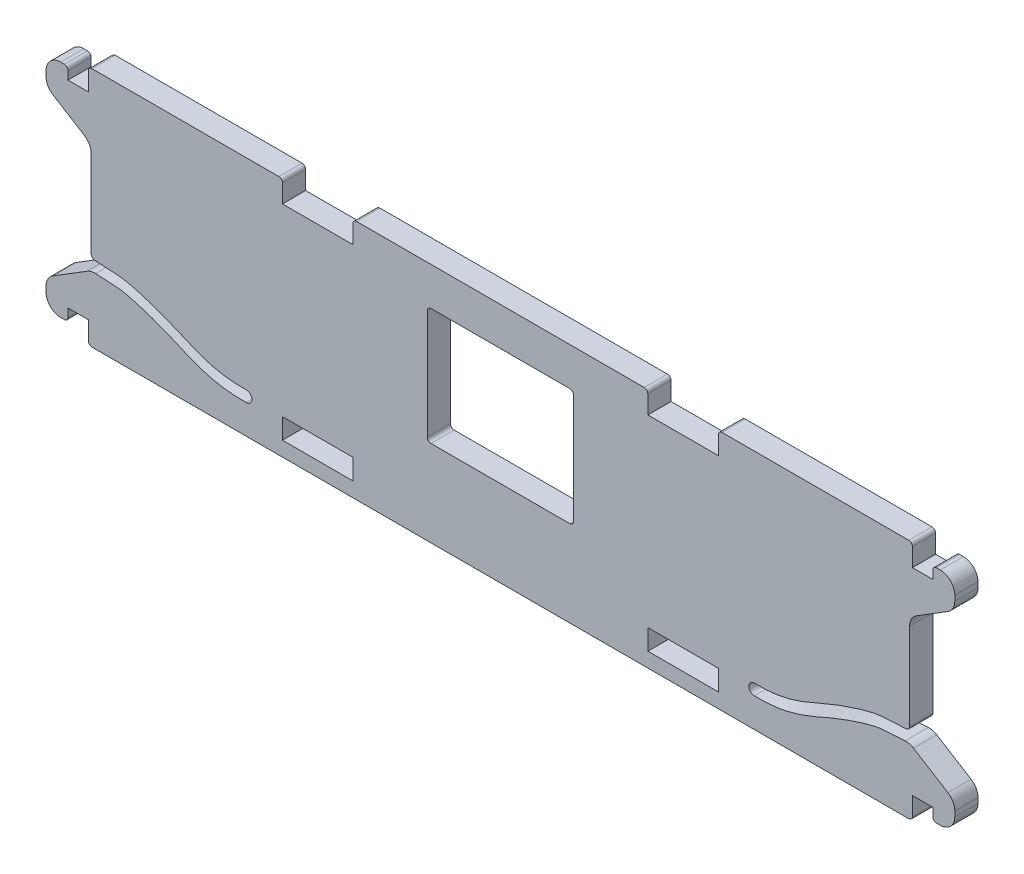
from build123d import *

# Parameters (mm, degrees)
SKETCH1_W           = 124.35
SKETCH1_H           = 33
BOSS_EXTRUDE1_DEPTH = 3.175
SKETCH2_W           = 9.65
SKETCH2_H           = 2.8
SKETCH2_H_2         = 3
CUT_EXTRUDE1_DEPTH  = 65.405444257
SKETCH4_W           = 2.8
SKETCH4_H           = 3
SKETCH4_W_2         = 6.175
SKETCH4_H_2         = 15
CUT_EXTRUDE2_DEPTH  = 65.405444257
SKETCH6_W           = 3
SKETCH6_H           = 1.375
CUT_EXTRUDE3_DEPTH  = 65.405444257
CUT_SWEEP1_DEPTH    = 3.175
SKETCH12_R          = 0.75
CUT_EXTRUDE6_DEPTH  = 65.405444385
CUT_EXTRUDE7_DEPTH  = 65.405444385
FILLET6_R           = 2
FILLET7_R           = 0.5
SKETCH14_W          = 20
SKETCH14_H          = 16
CUT_EXTRUDE8_DEPTH  = 65.405444385
FILLET8_R           = 0.5


# Read off the part's stored shape, not the designer's step: Cut-Sweep1
with BuildPart() as part:
    # Sketch1 → Boss-Extrude1 (new body)
    with BuildSketch(Plane.XY):
        Rectangle(SKETCH1_W, SKETCH1_H)
    extrude(amount=BOSS_EXTRUDE1_DEPTH)

    # Sketch2 → Cut-Extrude1 (cut, through all)
    with BuildSketch(Plane.XY.offset(3.175)):
        with Locations((-25, -13.1)):
            Rectangle(SKETCH2_W, SKETCH2_H)
        with Locations((25, -13.1)):
            Rectangle(SKETCH2_W, SKETCH2_H)
        with Locations((-25, 15)):
            Rectangle(SKETCH2_W, SKETCH2_H_2)
        with Locations((25, 15)):
            Rectangle(SKETCH2_W, SKETCH2_H_2)
    extrude(amount=-CUT_EXTRUDE1_DEPTH, mode=Mode.SUBTRACT)

    # Sketch4 → Cut-Extrude2 (cut, through all)
    with BuildSketch(Plane.XY.offset(3.175)):
        with Locations((-57.775, 15)):
            Rectangle(SKETCH4_W, SKETCH4_H)
        with Locations((-59.0875, 0)):
            Rectangle(SKETCH4_W_2, SKETCH4_H_2)
        with Locations((-57.775, -15)):
            Rectangle(SKETCH4_W, SKETCH4_H)
        with Locations((57.775, 15)):
            Rectangle(SKETCH4_W, SKETCH4_H)
        with Locations((59.0875, 0)):
            Rectangle(SKETCH4_W_2, SKETCH4_H_2)
        with Locations((57.775, -15)):
            Rectangle(SKETCH4_W, SKETCH4_H)
    extrude(amount=-CUT_EXTRUDE2_DEPTH, mode=Mode.SUBTRACT)

    # Sketch6 → Cut-Extrude3 (cut, through all)
    with BuildSketch(Plane.XY.offset(3.175)):
        with Locations((-60.675, 15.8125)):
            Rectangle(SKETCH6_W, SKETCH6_H)
        with Locations((-60.675, -15.8125)):
            Rectangle(SKETCH6_W, SKETCH6_H)
        with Locations((60.675, 15.8125)):
            Rectangle(SKETCH6_W, SKETCH6_H)
        with Locations((60.675, -15.8125)):
            Rectangle(SKETCH6_W, SKETCH6_H)
    extrude(amount=-CUT_EXTRUDE3_DEPTH, mode=Mode.SUBTRACT)

    # Cut-Sweep1 outline → Cut-Sweep1 (cut)
    with BuildSketch(Plane.XY):
        with BuildLine():
            add(Edge.make_bspline(
                [(-56, -6), (-55.016272395, -6.040912607), (-53.484317245, -6.110006936), (-52.10462272, -6.208217255), (-51.370216858, -6.312882143), (-50.849013323, -6.424427059), (-50.274077583, -6.562740427), (-49.507561658, -6.770408498), (-47.98416767, -7.234467607), (-46.535590196, -7.742954919), (-44.899823838, -8.383891144), (-43.265010906, -9.091671777), (-41.074137026, -10.055384808), (-38.357692762, -10.850187014), (-36.1078612, -11.027108547), (-34.793437631, -10.999002823)],
                knots=[0, 0, 0, 0, 0.052266667, 0.104533333, 0.1568, 0.188540911, 0.209066667, 0.261333333, 0.3136, 0.4368, 0.46346514, 0.56, 0.706666667, 0.853333333, 1, 1, 1, 1], degree=3))
            Line((-56, -6), (-56, -7.5))
            add(Edge.make_bspline(
                [(-56, -7.5), (-55.020423649, -7.540842864), (-53.496771007, -7.609797709), (-52.171479553, -7.70829789), (-51.569513747, -7.80075633), (-51.115986388, -7.900930823), (-50.592043829, -8.028791809), (-49.863497697, -8.22781936), (-48.398796638, -8.676488924), (-46.992197023, -9.172450468), (-45.412650318, -9.7933523), (-43.831176536, -10.480660701), (-41.561928867, -11.478467634), (-38.556226285, -12.350501385), (-36.110914304, -12.525218982), (-34.698750526, -12.49601129)],
                knots=[0, 0, 0, 0, 0.052266667, 0.104533333, 0.1568, 0.188540911, 0.209066667, 0.261333333, 0.3136, 0.4368, 0.46346514, 0.56, 0.706666667, 0.853333333, 1, 1, 1, 1], degree=3))
            Line((-34.698750526, -12.49601129), (-34.793437631, -10.999002823))
        make_face()
    cut_sweep1 = extrude(amount=CUT_SWEEP1_DEPTH, mode=Mode.SUBTRACT)

    # Mirror1: Cut-Sweep1 across plane
    add(cut_sweep1.mirror(Plane.ZY), mode=Mode.SUBTRACT)

    # Sketch12 → Cut-Extrude6 (cut, through all)
    with BuildSketch(Plane.XY.offset(3.175)):
        with Locations((-34.746094079, -11.747507056)):
            Circle(SKETCH12_R)
        with Locations((34.746094079, -11.747507056)):
            Circle(SKETCH12_R)
    extrude(amount=-CUT_EXTRUDE6_DEPTH, mode=Mode.SUBTRACT)

    # Sketch13 → Cut-Extrude7 (cut, through all)
    with BuildSketch(Plane.XY.offset(3.175)):
        Polygon((-56, 7.5), (-62.175, 11.3125), (-62.175, 7.5), align=None)
        Polygon((-56, -7.5), (-62.175, -11.3125), (-62.175, -7.5), align=None)
        Polygon((56, 7.5), (62.175, 11.3125), (62.175, 7.5), align=None)
        Polygon((56, -7.5), (62.175, -11.3125), (62.175, -7.5), align=None)
    extrude(amount=-CUT_EXTRUDE7_DEPTH, mode=Mode.SUBTRACT)

    # Fillet6
    fillet6_edges = [part.edges().sort_by_distance(p)[0] for p in [
        (62.175, -15.125, 1.5875),
        (62.175, -11.3125, 1.5875),
        (56, -7.5, 1.5875),
        (56, 7.5, 1.5875),
        (62.175, 11.3125, 1.5875),
        (62.175, 15.125, 1.5875),
        (-62.175, -15.125, 1.5875),
        (-62.175, -11.3125, 1.5875),
        (-56, -7.5, 1.5875),
        (-62.175, 15.125, 1.5875),
        (-62.175, 11.3125, 1.5875),
        (-56, 7.5, 1.5875),
    ]]
    fillet(fillet6_edges, radius=FILLET6_R)

    # Fillet7
    fillet7_edges = [part.edges().sort_by_distance(p)[0] for p in [
        (59.175, 15.125, 1.5875),
        (59.175, -15.125, 1.5875),
        (-59.175, -15.125, 1.5875),
        (-59.175, 15.125, 1.5875),
        (20.175, 16.5, 1.5875),
        (29.825, 16.5, 1.5875),
        (-20.175, 16.5, 1.5875),
        (-29.825, 16.5, 1.5875),
        (56.375, -16.5, 1.5875),
        (56, -6, 1.5875),
        (56.375, 16.5, 1.5875),
        (-56.375, 16.5, 1.5875),
        (-56.375, -16.5, 1.5875),
        (-56, -6, 1.5875),
    ]]
    fillet(fillet7_edges, radius=FILLET7_R)

    # Sketch14 → Cut-Extrude8 (cut, through all)
    with BuildSketch(Plane.XY.offset(3.175)):
        with Locations((0, 3.275)):
            Rectangle(SKETCH14_W, SKETCH14_H)
    extrude(amount=-CUT_EXTRUDE8_DEPTH, mode=Mode.SUBTRACT)

    # Fillet8
    fillet8_edges = [part.edges().sort_by_distance(p)[0] for p in [
        (-10, -4.725, 1.5875),
        (-10, 11.275, 1.5875),
        (10, 11.275, 1.5875),
        (10, -4.725, 1.5875),
    ]]
    fillet(fillet8_edges, radius=FILLET8_R)


solid = part.part
